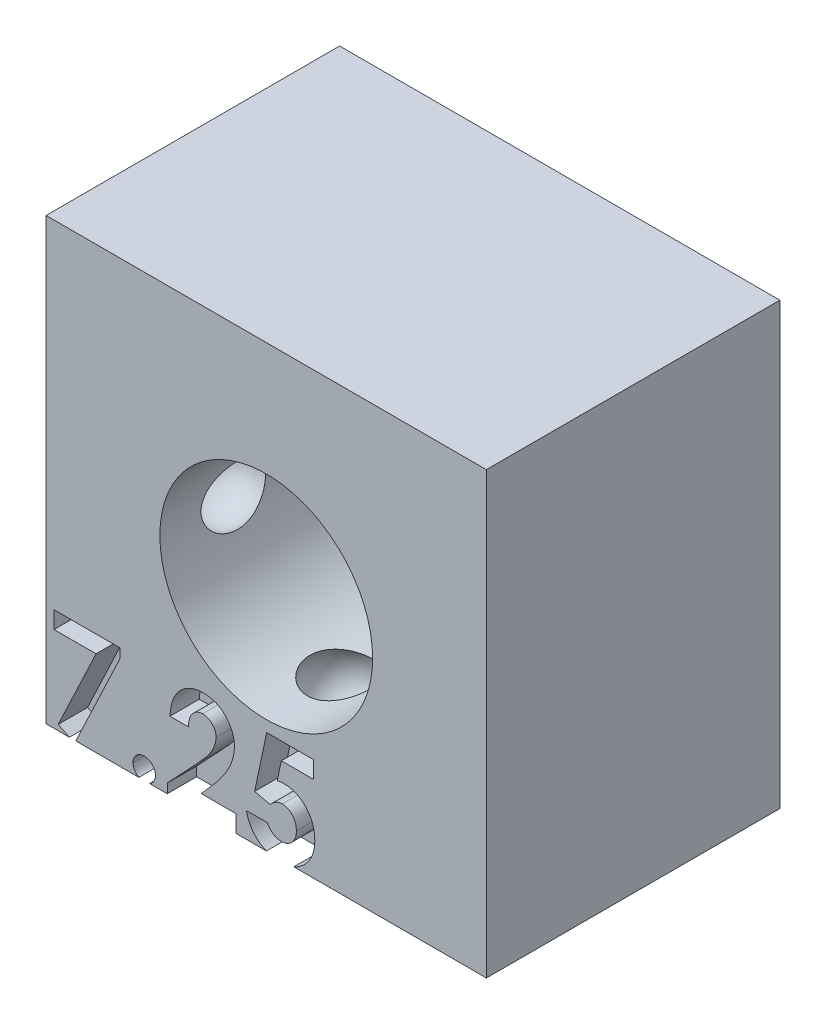
from build123d import *

# Parameters (mm, degrees)
SKETCH1_W           = 15
SKETCH1_H           = 15
SKETCH1_R           = 3.625
BOSS_EXTRUDE1_DEPTH = 10
CIRPATTERN1_COUNT   = 4
CUT_EXTRUDE5_DEPTH  = 1


with BuildPart() as part:
    # Sketch1 → Boss-Extrude1 (new body)
    with BuildSketch(Plane.XY):
        with Locations((7.5, 7.5)):
            Rectangle(SKETCH1_W, SKETCH1_H)
        with Locations((7.5, 7.5)):
            Circle(SKETCH1_R, mode=Mode.SUBTRACT)
    extrude(amount=BOSS_EXTRUDE1_DEPTH)

    # Sketch2 → Cut-Revolve1 (revolve, cut)
    with BuildSketch(Plane(origin=(7.5, 0, 0), x_dir=(0, 0, -1), z_dir=(1, 0, 0))):
        with BuildLine():
            ThreePointArc((-6.25, 11.718717104), (-7.5, 12.968717104), (-8.75, 11.718717104))
            Line((-8.75, 11.718717104), (-6.25, 11.718717104))
        make_face()
    cut_revolve1 = revolve(axis=Axis((7.5, 11.718717104, 8.75), (0, 0, -1)), mode=Mode.SUBTRACT)

    # CirPattern1: Cut-Revolve1 ×4 about axis
    cirpattern1_axis = Axis((7.5, 7.5, 10), (0, 0, -1))
    for i in range(1, CIRPATTERN1_COUNT):
        add(cut_revolve1.rotate(cirpattern1_axis, i * 360 / CIRPATTERN1_COUNT), mode=Mode.SUBTRACT)

    # LPattern1 copy 1 sketch → LPattern1 copy 1 (revolve, cut)
    with BuildSketch(Plane(origin=(0, 7.5, -5), x_dir=(0, 0, -1), z_dir=(0, -1, 0))):
        with BuildLine():
            ThreePointArc((-6.25, 11.718717104), (-7.5, 12.968717104), (-8.75, 11.718717104))
            Line((-8.75, 11.718717104), (-6.25, 11.718717104))
        make_face()
    revolve(axis=Axis((11.718717104, 7.5, 3.75), (0, 0, -1)), mode=Mode.SUBTRACT)

    # LPattern1 copy 2 sketch → LPattern1 copy 2 (revolve, cut)
    with BuildSketch(Plane(origin=(7.5, 15, -5), x_dir=(0, 0, -1), z_dir=(-1, 0, 0))):
        with BuildLine():
            ThreePointArc((-6.25, 11.718717104), (-7.5, 12.968717104), (-8.75, 11.718717104))
            Line((-8.75, 11.718717104), (-6.25, 11.718717104))
        make_face()
    revolve(axis=Axis((7.5, 3.281282896, 3.75), (0, 0, -1)), mode=Mode.SUBTRACT)

    # LPattern1 copy 3 sketch → LPattern1 copy 3 (revolve, cut)
    with BuildSketch(Plane(origin=(15, 7.5, -5), x_dir=(0, 0, -1), z_dir=(0, 1, 0))):
        with BuildLine():
            ThreePointArc((-6.25, 11.718717104), (-7.5, 12.968717104), (-8.75, 11.718717104))
            Line((-8.75, 11.718717104), (-6.25, 11.718717104))
        make_face()
    revolve(axis=Axis((3.281282896, 7.5, 3.75), (0, 0, -1)), mode=Mode.SUBTRACT)

    # LPattern1 copy 4 sketch → LPattern1 copy 4 (revolve, cut)
    with BuildSketch(Plane(origin=(7.5, 0, -5), x_dir=(0, 0, -1), z_dir=(1, 0, 0))):
        with BuildLine():
            ThreePointArc((-6.25, 11.718717104), (-7.5, 12.968717104), (-8.75, 11.718717104))
            Line((-8.75, 11.718717104), (-6.25, 11.718717104))
        make_face()
    revolve(axis=Axis((7.5, 11.718717104, 3.75), (0, 0, -1)), mode=Mode.SUBTRACT)

    # Sketch7 → Cut-Extrude5 (cut)
    with BuildSketch(Plane.XY.offset(10)):
        Polygon((0.269230769, 3.5), (2.512820513, 3.5), (2.512820513, 3.173978365), (0.968950321, -0.08974359), (0.412960737, 0.190705128), (1.702323718, 2.916666667), (0.269230769, 2.916666667), align=None)
        with BuildLine():
            add(Edge.make_bspline(
                [(3.342948718, 0.717948718), (3.368308614, 0.716558296), (3.41823787, 0.713820795), (3.490378837, 0.69339111), (3.555486475, 0.656686271), (3.613701402, 0.608811171), (3.662926479, 0.551211032), (3.698505251, 0.485525117), (3.720661045, 0.41366212), (3.72310706, 0.36357578), (3.724358974, 0.337940705)],
                knots=[0, 0, 0, 0, 1.016957001, 2.002212695, 2.9757545, 3.99499976, 5.013036768, 5.994806404, 6.97370641, 8, 8, 8, 8], degree=3))
            add(Edge.make_bspline(
                [(3.724358974, 0.337940705), (3.723115262, 0.312301513), (3.72068527, 0.262207129), (3.698351935, 0.190204101), (3.662979645, 0.123978308), (3.613697453, 0.065760947), (3.555727563, 0.016983595), (3.490229143, -0.019382772), (3.418375297, -0.04097138), (3.368332803, -0.043559148), (3.342948718, -0.044871795)],
                knots=[0, 0, 0, 0, 1.023218912, 1.999186227, 2.986238111, 4.008388923, 5.030539734, 6.0011649, 6.986089706, 8, 8, 8, 8], degree=3))
            add(Edge.make_bspline(
                [(3.342948718, -0.044871795), (3.317558618, -0.043569822), (3.267504267, -0.041003097), (3.195538729, -0.019200801), (3.129556749, 0.016740799), (3.071572294, 0.065820114), (3.022069931, 0.123772156), (2.987703307, 0.190413056), (2.965161943, 0.262179983), (2.962765172, 0.312292323), (2.961538462, 0.337940705)],
                knots=[0, 0, 0, 0, 1.013427518, 1.99788335, 2.976245624, 3.997909735, 5.019573847, 6.001765691, 6.977268297, 8, 8, 8, 8], degree=3))
            add(Edge.make_bspline(
                [(2.961538462, 0.337940705), (2.962773265, 0.363585131), (2.965185849, 0.413689738), (2.987550428, 0.485313756), (3.022125009, 0.551418305), (3.071568166, 0.608751881), (3.129799079, 0.656927172), (3.195388195, 0.693211633), (3.267641624, 0.713852746), (3.317582778, 0.716569058), (3.342948718, 0.717948718)],
                knots=[0, 0, 0, 0, 1.025808215, 2.00424526, 2.981110158, 3.998665696, 5.017428914, 5.998734231, 6.983523959, 8, 8, 8, 8], degree=3))
        make_face()
        with BuildLine():
            Line((4.846153846, 2.333333333), (4.217948718, 2.333333333))
            add(Edge.make_bspline(
                [(4.217948718, 2.333333333), (4.22066184, 2.380853728), (4.225963116, 2.473705726), (4.247050255, 2.608576225), (4.275306298, 2.736014017), (4.313017737, 2.855573308), (4.360404629, 2.967210656), (4.416247585, 3.071306638), (4.481973267, 3.167313186), (4.556182816, 3.254767303), (4.637616358, 3.333223199), (4.724583253, 3.402787125), (4.818413776, 3.460189525), (4.917393568, 3.507426387), (5.021505773, 3.545166444), (5.131735457, 3.570398727), (5.247128192, 3.587486275), (5.326123863, 3.588981504), (5.366386218, 3.58974359)],
                knots=[0, 0, 0, 0, 1.199038563, 2.342849363, 3.436047546, 4.486744587, 5.497670872, 6.488682221, 7.459191391, 8.424610317, 9.374430501, 10.305433194, 11.225809216, 12.140057399, 13.06607119, 14.010487599, 14.985989317, 16, 16, 16, 16], degree=3))
            add(Edge.make_bspline(
                [(5.366386218, 3.58974359), (5.415807687, 3.58820151), (5.512289978, 3.585191008), (5.652486399, 3.559510428), (5.783414527, 3.516555691), (5.90497919, 3.456536594), (6.016145488, 3.380288623), (6.116894985, 3.289375396), (6.204180855, 3.181889507), (6.278556518, 3.062303267), (6.340353805, 2.93567827), (6.383658769, 2.804742772), (6.412122656, 2.67297127), (6.415158506, 2.584243011), (6.416666667, 2.540164263)],
                knots=[0, 0, 0, 0, 1.075374347, 2.099382735, 3.09057751, 4.06680945, 5.040638231, 6.016817125, 7.011024321, 8.044445721, 9.0776792, 10.070479129, 11.0414456, 12, 12, 12, 12], degree=3))
            add(Edge.make_bspline(
                [(6.416666667, 2.540164263), (6.416079469, 2.513502321), (6.414897584, 2.459838418), (6.406679783, 2.378631761), (6.394351458, 2.295913287), (6.375763349, 2.211753919), (6.352582452, 2.126130065), (6.324460674, 2.038785484), (6.290745702, 1.950215386), (6.252000171, 1.859422931), (6.205776653, 1.766113351), (6.151955793, 1.668887899), (6.089109061, 1.567832821), (6.017995567, 1.462377529), (5.938269931, 1.35268834), (5.849542957, 1.239095673), (5.752836572, 1.121199265), (5.684201331, 1.042392132), (5.648938301, 1.001903045)],
                knots=[0, 0, 0, 0, 0.728284026, 1.46585585, 2.227944881, 3.01186502, 3.81876927, 4.650621989, 5.517437689, 6.406905708, 7.346299482, 8.360816762, 9.441613733, 10.596154504, 11.834900912, 13.145207542, 14.533280747, 16, 16, 16, 16], degree=3))
            Line((5.648938301, 1.001903045), (5.283653846, 0.583333333))
            Line((5.283653846, 0.583333333), (6.461538462, 0.583333333))
            Line((6.461538462, 0.583333333), (6.461538462, 0))
            Line((6.461538462, 0), (4.128205128, 0))
            Line((4.128205128, 0), (4.128205128, 0.318309295))
            Line((4.128205128, 0.318309295), (5.164463141, 1.421173878))
            add(Edge.make_bspline(
                [(5.164463141, 1.421173878), (5.194465473, 1.453344781), (5.252571094, 1.515650278), (5.335249404, 1.60715253), (5.410065971, 1.693985982), (5.475469413, 1.777075237), (5.534892018, 1.853725216), (5.585684137, 1.926246247), (5.628310478, 1.993982712), (5.674587418, 2.075661059), (5.718535297, 2.173077022), (5.758860137, 2.285304206), (5.783440917, 2.392567547), (5.786833842, 2.462462646), (5.788461538, 2.49599359)],
                knots=[0, 0, 0, 0, 1.246127091, 2.413378631, 3.493388633, 4.492180848, 5.408488754, 6.240484944, 6.999099869, 7.674939598, 8.898438119, 10.020720584, 11.050475521, 12, 12, 12, 12], degree=3))
            add(Edge.make_bspline(
                [(5.788461538, 2.49599359), (5.787244549, 2.528432191), (5.784886438, 2.591287182), (5.758972705, 2.680698073), (5.71882625, 2.761650506), (5.662254226, 2.831725534), (5.593727787, 2.889310831), (5.514539049, 2.932141156), (5.425333634, 2.956854058), (5.362798939, 2.959947231), (5.330629006, 2.961538462)],
                knots=[0, 0, 0, 0, 1.062038974, 2.057870785, 3.028805853, 4.01125022, 4.991535629, 5.949134679, 6.94496649, 8, 8, 8, 8], degree=3))
            add(Edge.make_bspline(
                [(5.330629006, 2.961538462), (5.314009609, 2.960950642), (5.281291658, 2.959793424), (5.233198826, 2.952090139), (5.187435041, 2.938513903), (5.143490927, 2.920323658), (5.101835467, 2.896212358), (5.062573729, 2.866491338), (5.025292041, 2.831915879), (4.990161392, 2.792594092), (4.958187915, 2.748710967), (4.92978919, 2.700667285), (4.906308172, 2.64849287), (4.885634631, 2.592876502), (4.869690206, 2.533220817), (4.858080687, 2.469882848), (4.849254745, 2.402965636), (4.847206283, 2.356966346), (4.846153846, 2.333333333)],
                knots=[0, 0, 0, 0, 0.903469896, 1.778625579, 2.63899355, 3.493148037, 4.358286772, 5.247621495, 6.164656832, 7.118446693, 8.109501108, 9.111810964, 10.146451449, 11.215617525, 12.33435995, 13.498009769, 14.714554818, 16, 16, 16, 16], degree=3))
        make_face()
        with BuildLine():
            Line((7.515324519, 3.5), (9.108974359, 3.5))
            Line((9.108974359, 3.5), (9.108974359, 2.916666667))
            Line((9.108974359, 2.916666667), (8.013120994, 2.916666667))
            Line((8.013120994, 2.916666667), (7.876402244, 2.254807692))
            add(Edge.make_bspline(
                [(7.876402244, 2.254807692), (7.89503213, 2.259996351), (7.931774095, 2.270229452), (7.98712591, 2.280491957), (8.040769532, 2.287143787), (8.07597015, 2.288031053), (8.093048878, 2.288461538)],
                knots=[0, 0, 0, 0, 1.05461699, 2.079921384, 3.068411212, 4, 4, 4, 4], degree=3))
            add(Edge.make_bspline(
                [(8.093048878, 2.288461538), (8.130265216, 2.287608748), (8.203626816, 2.285927709), (8.310945528, 2.26996917), (8.413709535, 2.244834954), (8.511604367, 2.208988378), (8.604534394, 2.162333132), (8.692612265, 2.105893363), (8.775946082, 2.039569942), (8.853055486, 1.963321345), (8.923906826, 1.879598659), (8.985508026, 1.789043716), (9.038119295, 1.69294774), (9.079964479, 1.590713401), (9.112992266, 1.4829828), (9.136858882, 1.3696869), (9.150972405, 1.250691427), (9.152875527, 1.169509324), (9.153846154, 1.128104968)],
                knots=[0, 0, 0, 0, 1.01440847, 1.999622559, 2.951875003, 3.895578053, 4.836219714, 5.782137149, 6.743708247, 7.735272588, 8.734977101, 9.730283169, 10.717124674, 11.717316708, 12.737475749, 13.78628267, 14.87096371, 16, 16, 16, 16], degree=3))
            add(Edge.make_bspline(
                [(9.153846154, 1.128104968), (9.152660032, 1.086230577), (9.150319467, 1.003600162), (9.135049425, 0.882104224), (9.108097527, 0.765738544), (9.071076398, 0.654191613), (9.022303431, 0.548283274), (8.963647263, 0.446916397), (8.894116176, 0.350843395), (8.814392509, 0.261049133), (8.727722424, 0.178975454), (8.635439244, 0.106775081), (8.538191284, 0.046019052), (8.435976199, -0.003082091), (8.329380428, -0.041930041), (8.218371619, -0.070209495), (8.102410284, -0.08642619), (8.023687604, -0.088625638), (7.983673878, -0.08974359)],
                knots=[0, 0, 0, 0, 1.06808661, 2.107647099, 3.116961351, 4.110378221, 5.100014249, 6.085620622, 7.093190682, 8.119403071, 9.144090782, 10.133780668, 11.103064255, 12.062861538, 13.020824475, 13.992378307, 14.979551724, 16, 16, 16, 16], degree=3))
            add(Edge.make_bspline(
                [(7.983673878, -0.08974359), (7.947890795, -0.088829036), (7.877319066, -0.087025345), (7.773370007, -0.075938907), (7.673151571, -0.056337982), (7.577195808, -0.027970368), (7.484493103, 0.006943689), (7.396115127, 0.050610316), (7.311576226, 0.10219804), (7.231116459, 0.160765386), (7.156043183, 0.226739229), (7.087524252, 0.298958967), (7.025144843, 0.376514305), (6.970239778, 0.460362042), (6.922981168, 0.550378295), (6.881071268, 0.645502204), (6.846767596, 0.746727166), (6.82935947, 0.816901933), (6.820512821, 0.852564103)],
                knots=[0, 0, 0, 0, 1.054957082, 2.080596141, 3.077793124, 4.061112343, 5.027190972, 5.994718051, 6.962465889, 7.943658696, 8.924948258, 9.904494768, 10.875059, 11.855380583, 12.854004648, 13.869083016, 14.917087635, 16, 16, 16, 16], degree=3))
            Line((6.820512821, 0.852564103), (7.538461538, 0.852564103))
            add(Edge.make_bspline(
                [(7.538461538, 0.852564103), (7.551585658, 0.827851671), (7.577090888, 0.779825881), (7.625607472, 0.716064428), (7.679918709, 0.661691401), (7.73953468, 0.616175562), (7.804841661, 0.58207587), (7.873178514, 0.556216242), (7.945403728, 0.54127292), (7.994592288, 0.539404857), (8.01943109, 0.538461538)],
                knots=[0, 0, 0, 0, 1.104910296, 2.147267069, 3.153527244, 4.136738762, 5.099945312, 6.05603338, 7.018353, 8, 8, 8, 8], degree=3))
            add(Edge.make_bspline(
                [(8.01943109, 0.538461538), (8.036743401, 0.539112908), (8.070805667, 0.540394488), (8.120991028, 0.547174369), (8.16889516, 0.560015309), (8.214874219, 0.577797026), (8.259051716, 0.599972835), (8.300794351, 0.62796835), (8.340828371, 0.660192225), (8.378544297, 0.697169231), (8.412704054, 0.738389992), (8.442658424, 0.782684509), (8.469441762, 0.829068549), (8.48928059, 0.879379501), (8.505526912, 0.932115061), (8.517491361, 0.98767303), (8.524641469, 1.046118294), (8.525303378, 1.086017238), (8.525641026, 1.106370192)],
                knots=[0, 0, 0, 0, 0.978869489, 1.925942215, 2.855067702, 3.774946051, 4.70828698, 5.642468714, 6.60995405, 7.609372294, 8.622401667, 9.629904756, 10.629323, 11.642352373, 12.678539694, 13.745912462, 14.850161547, 16, 16, 16, 16], degree=3))
            add(Edge.make_bspline(
                [(8.525641026, 1.106370192), (8.525249146, 1.126250708), (8.524486343, 1.164948615), (8.518176284, 1.221771003), (8.506887711, 1.275685166), (8.491506932, 1.327104046), (8.4718177, 1.375715402), (8.447756141, 1.421808594), (8.419219464, 1.465150636), (8.386054459, 1.504859127), (8.35068764, 1.541280884), (8.312692312, 1.573135063), (8.272410792, 1.59957182), (8.23109478, 1.622651878), (8.187095089, 1.639449041), (8.141401094, 1.651016627), (8.09406085, 1.659504457), (8.061771097, 1.660003148), (8.045372596, 1.66025641)],
                knots=[0, 0, 0, 0, 1.166249705, 2.270133367, 3.348514167, 4.393962215, 5.415026464, 6.420877785, 7.440098956, 8.453121383, 9.451844239, 10.415694839, 11.355045125, 12.27538808, 13.187007209, 14.108269027, 15.039275622, 16, 16, 16, 16], degree=3))
            add(Edge.make_bspline(
                [(8.045372596, 1.66025641), (8.027560012, 1.659580522), (7.991859773, 1.658225896), (7.938818153, 1.647203668), (7.886416068, 1.629365569), (7.834362107, 1.604755084), (7.783172998, 1.572547724), (7.731497833, 1.534772184), (7.681066292, 1.488683712), (7.649000515, 1.454356913), (7.632411859, 1.436598558)],
                knots=[0, 0, 0, 0, 0.88288272, 1.769486374, 2.674910571, 3.623812639, 4.617874466, 5.670434592, 6.794841017, 8, 8, 8, 8], degree=3))
            Line((7.632411859, 1.436598558), (7.103766026, 1.557892628))
            Line((7.103766026, 1.557892628), (7.515324519, 3.5))
        make_face()
    extrude(amount=-CUT_EXTRUDE5_DEPTH, mode=Mode.SUBTRACT)


solid = part.part
